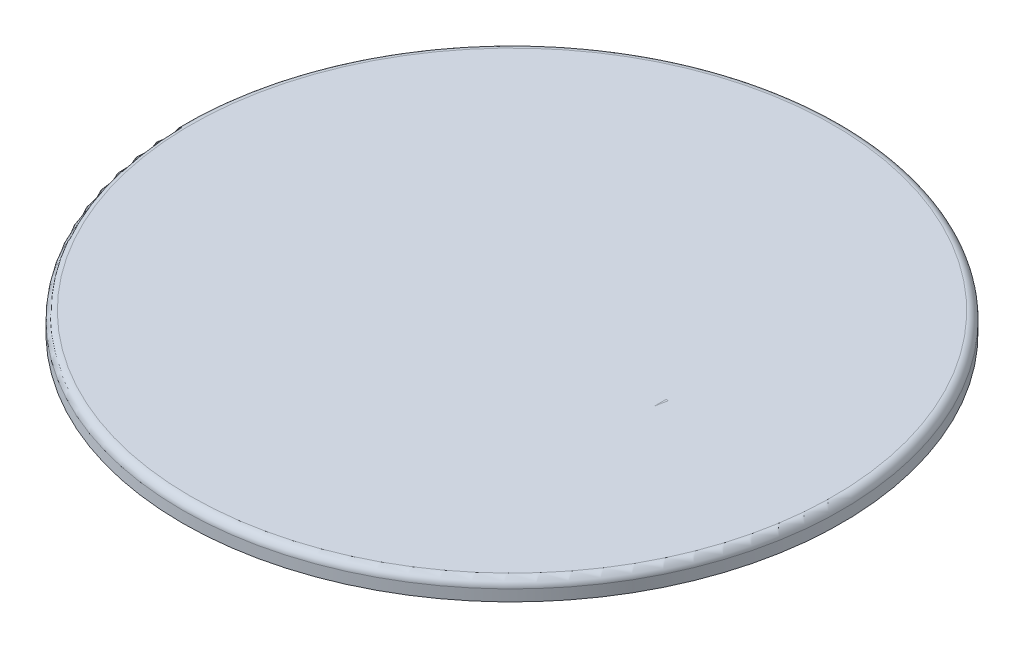
from build123d import *

# Parameters (mm, degrees)
SKETCH1_R           = 19.4
BOSS_EXTRUDE1_DEPTH = 15
SKETCH2_R           = 41
BOSS_EXTRUDE2_DEPTH = 2.4
FILLET1_R           = 2
FILLET3_R           = 2
FILLET5_R           = 1
SWEEP1_PITCH        = 4.333333333


with BuildPart() as part:
    # Sketch1 → Boss-Extrude1 (new body)
    with BuildSketch(Plane(origin=(0, 0, 0), x_dir=(1, 0, 0), z_dir=(0, 1, 0))):
        with Locations(Location((0, 0, 0), (0, 0, 270))):
            Circle(SKETCH1_R)
    extrude(amount=BOSS_EXTRUDE1_DEPTH)

    # Sketch2 → Boss-Extrude2 (add)
    with BuildSketch(Plane(origin=(0, 15, 0), x_dir=(1, 0, 0), z_dir=(0, 1, 0))):
        with Locations(Location((0, 0, 0), (0, 0, 270))):
            Circle(SKETCH2_R)
    extrude(amount=BOSS_EXTRUDE2_DEPTH)

    # Fillet1
    fillet1_edges = [part.edges().sort_by_distance(p)[0] for p in [
        (0, 15, -19.4),
    ]]
    fillet(fillet1_edges, radius=FILLET1_R)

    # Fillet3
    fillet3_edges = [part.edges().sort_by_distance(p)[0] for p in [
        (0, 0, -19.4),
    ]]
    fillet(fillet3_edges, radius=FILLET3_R)

    # Fillet5
    fillet5_edges = [part.edges().sort_by_distance(p)[0] for p in [
        (0, 17.4, -41),
    ]]
    fillet(fillet5_edges, radius=FILLET5_R)

    # Sweep1: the profile of Sketch3 screwed along a right-hand helix of 3.5 turns, 12 arcs to a turn; built about Z, then put on its axis
    sweep1_z = Axis((0, 0, 0), (0, 0, 1))
    sweep1_corners = [(19.2, 0, -1.250554803), (21.8, 0, -0.659645712), (21.8, 0, 0.659645712), (19.2, 0, 1.250554803)]
    with BuildLine(mode=Mode.PRIVATE) as sweep1_profile:
        Line(sweep1_corners[0], sweep1_corners[1])
        Line(sweep1_corners[1], sweep1_corners[2])
        Line(sweep1_corners[2], sweep1_corners[3])
        Line(sweep1_corners[3], sweep1_corners[0])
    sweep1_cap = Face(sweep1_profile.wire())
    sweep1_turn_angles = [0, 15, 30, 45, 60, 75, 90, 105, 120, 135, 150, 165, 180, 195, 210, 225, 240, 255, 270, 285, 300, 315, 330, 345, 360]
    sweep1_turn_weights = [1, 0.9659258262890683, 1, 0.9659258262890683, 1, 0.9659258262890683, 1, 0.9659258262890683, 1, 0.9659258262890683, 1, 0.9659258262890683, 1, 0.9659258262890683, 1, 0.9659258262890683, 1, 0.9659258262890683, 1, 0.9659258262890683, 1, 0.9659258262890683, 1, 0.9659258262890683, 1]
    sweep1_turn_rails = [Edge.make_bspline([Vector(p[0], p[1], 0).rotate(sweep1_z, sweep1_turn_angles[k]) / sweep1_turn_weights[k] + Vector(0, 0, p[2] + SWEEP1_PITCH * sweep1_turn_angles[k] / 360) for k in range(25)], [0, 0, 0, 1, 1, 2, 2, 3, 3, 4, 4, 5, 5, 6, 6, 7, 7, 8, 8, 9, 9, 10, 10, 11, 11, 12, 12, 12], 2, sweep1_turn_weights) for p in sweep1_corners]
    sweep1_turn_sides = [Face.make_surface_from_curves(sweep1_turn_rails[p[0]], sweep1_turn_rails[p[1]]) for p in [(0, 1), (1, 2), (2, 3), (3, 0)]]
    sweep1_last_angles = [1080, 1095, 1110, 1125, 1140, 1155, 1170, 1185, 1200, 1215, 1230, 1245, 1260]
    sweep1_last_weights = [1, 0.9659258262890683, 1, 0.9659258262890683, 1, 0.9659258262890683, 1, 0.9659258262890683, 1, 0.9659258262890683, 1, 0.965925826289057, 1]
    sweep1_last_rails = [Edge.make_bspline([Vector(p[0], p[1], 0).rotate(sweep1_z, sweep1_last_angles[k]) / sweep1_last_weights[k] + Vector(0, 0, p[2] + SWEEP1_PITCH * sweep1_last_angles[k] / 360) for k in range(13)], [0, 0, 0, 1, 1, 2, 2, 3, 3, 4, 4, 5, 5, 6, 6, 6], 2, sweep1_last_weights) for p in sweep1_corners]
    sweep1_last_sides = [Face.make_surface_from_curves(sweep1_last_rails[p[0]], sweep1_last_rails[p[1]]) for p in [(0, 1), (1, 2), (2, 3), (3, 0)]]
    sweep1 = Plane(origin=(0, 16.2, 0), x_dir=(1, 0, 0), z_dir=(0, -1, 0)) * Solid(Shell([*[p.moved(Location((0, 0, SWEEP1_PITCH * i))) for i in range(3) for p in sweep1_turn_sides], *sweep1_last_sides, sweep1_cap, sweep1_cap.rotate(sweep1_z, 1260).moved(Location((0, 0, SWEEP1_PITCH * 1260 / 360)))]))
    add(sweep1)


solid = part.part
